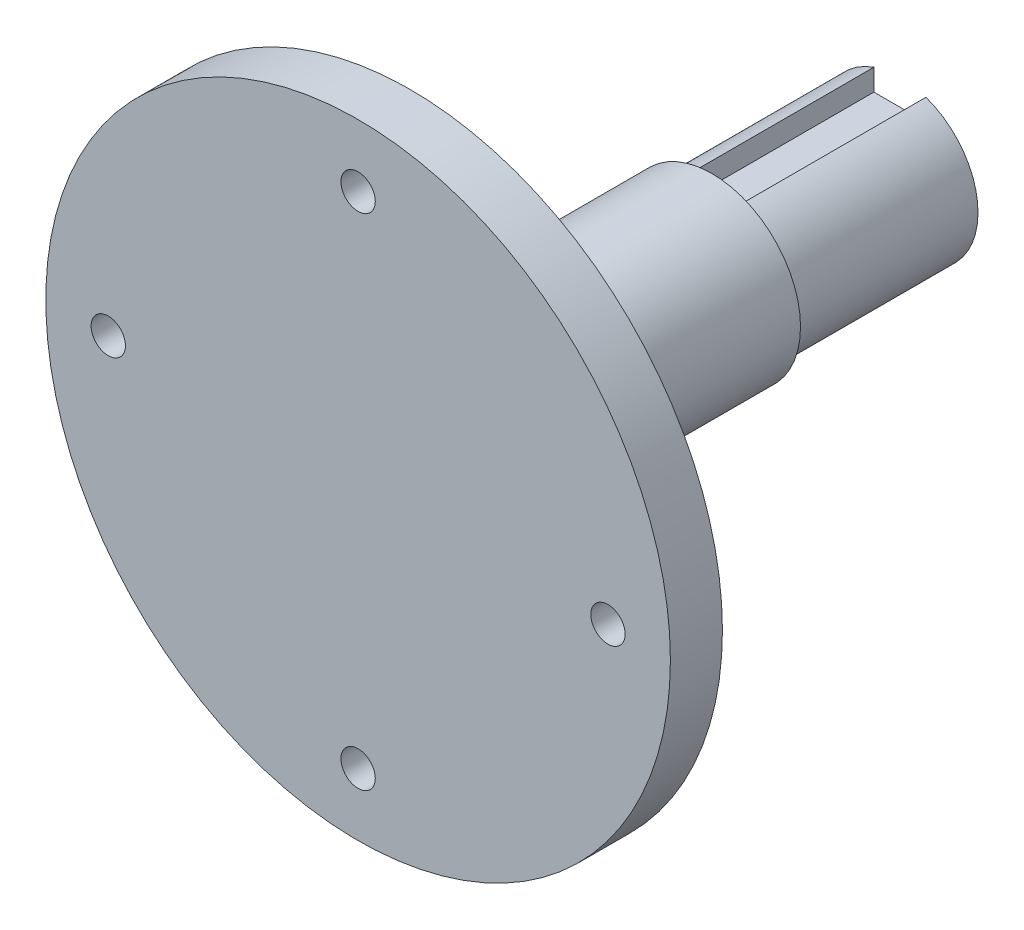
from build123d import *

# Parameters (mm, degrees)
SKETCH1_R                 = 7.5
BOSS_EXTRUDE1_DEPTH       = 20.05
SKETCH3_W                 = 5
SKETCH3_H                 = 5
CUT_EXTRUDE1_DEPTH        = 21
SKETCH6_R                 = 8.5
BOSS_EXTRUDE2_DEPTH       = 24
SKETCH7_R                 = 11.25
BOSS_EXTRUDE3_DEPTH       = 5
SKETCH8_R                 = 30
BOSS_EXTRUDE4_DEPTH       = 5
FILLET1_R                 = 0.6
FILLET2_R                 = 5
M4X0_7_TAPPED_HOLE1_D     = 3.3
M6X1_0_TAPPED_HOLE2_D     = 5
M6X1_0_TAPPED_HOLE2_DEPTH = 23.497848452
M6X1_0_TAPPED_HOLE2_TIP   = 1.502151548
SKETCH13_R                = 7.5
CUT_EXTRUDE2_DEPTH        = 2


with BuildPart() as part:
    # Sketch1 → Boss-Extrude1 (new body)
    with BuildSketch(Plane.XY):
        Circle(SKETCH1_R)
    extrude(amount=BOSS_EXTRUDE1_DEPTH)

    # Sketch3 → Cut-Extrude1 (cut)
    with BuildSketch(Plane(origin=(0, 0, 0), x_dir=(-1, 0, 0), z_dir=(0, 0, -1))):
        with Locations((0, 7.5)):
            Rectangle(SKETCH3_W, SKETCH3_H)
    extrude(amount=-CUT_EXTRUDE1_DEPTH, mode=Mode.SUBTRACT)

    # Sketch6 → Boss-Extrude2 (add)
    with BuildSketch(Plane.XY.offset(20.05)):
        Circle(SKETCH6_R)
    extrude(amount=BOSS_EXTRUDE2_DEPTH)

    # Sketch7 → Boss-Extrude3 (add)
    with BuildSketch(Plane.XY.offset(44.05)):
        Circle(SKETCH7_R)
    extrude(amount=BOSS_EXTRUDE3_DEPTH)

    # Sketch8 → Boss-Extrude4 (add)
    with BuildSketch(Plane.XY.offset(49.05)):
        Circle(SKETCH8_R)
    extrude(amount=BOSS_EXTRUDE4_DEPTH)

    # Fillet1
    fillet1_edges = [part.edges().sort_by_distance(p)[0] for p in [
        (-8.5, 0, 44.05),
    ]]
    fillet(fillet1_edges, radius=FILLET1_R)

    # Fillet2
    fillet2_edges = [part.edges().sort_by_distance(p)[0] for p in [
        (-11.25, 0, 49.05),
    ]]
    fillet(fillet2_edges, radius=FILLET2_R - 0.0001)  # a hair under: the kernel refuses the full size

    # M4x0.7 Tapped Hole1 (through all)
    with Locations(Plane.XY.offset(54.05)):
        with Locations((0, 24), (0, -24), (24, 0), (-24, 0)):
            Hole(M4X0_7_TAPPED_HOLE1_D / 2)

    # M6x1.0 Tapped Hole2
    with Locations(Plane(origin=(0, 0, 0), x_dir=(-1, 0, 0), z_dir=(0, 0, -1))):
        with Locations((0, 0)):
            Hole(M6X1_0_TAPPED_HOLE2_D / 2, depth=M6X1_0_TAPPED_HOLE2_DEPTH)
            with Locations((0, 0, -(M6X1_0_TAPPED_HOLE2_DEPTH + M6X1_0_TAPPED_HOLE2_TIP / 2))):  # 118° drill point
                Cone(0, M6X1_0_TAPPED_HOLE2_D / 2, M6X1_0_TAPPED_HOLE2_TIP, mode=Mode.SUBTRACT)

    # Sketch13 → Cut-Extrude2 (cut)
    with BuildSketch(Plane(origin=(0, 0, 0), x_dir=(-1, 0, 0), z_dir=(0, 0, -1))):
        Circle(SKETCH13_R)
    extrude(amount=-CUT_EXTRUDE2_DEPTH, mode=Mode.SUBTRACT)


solid = part.part
